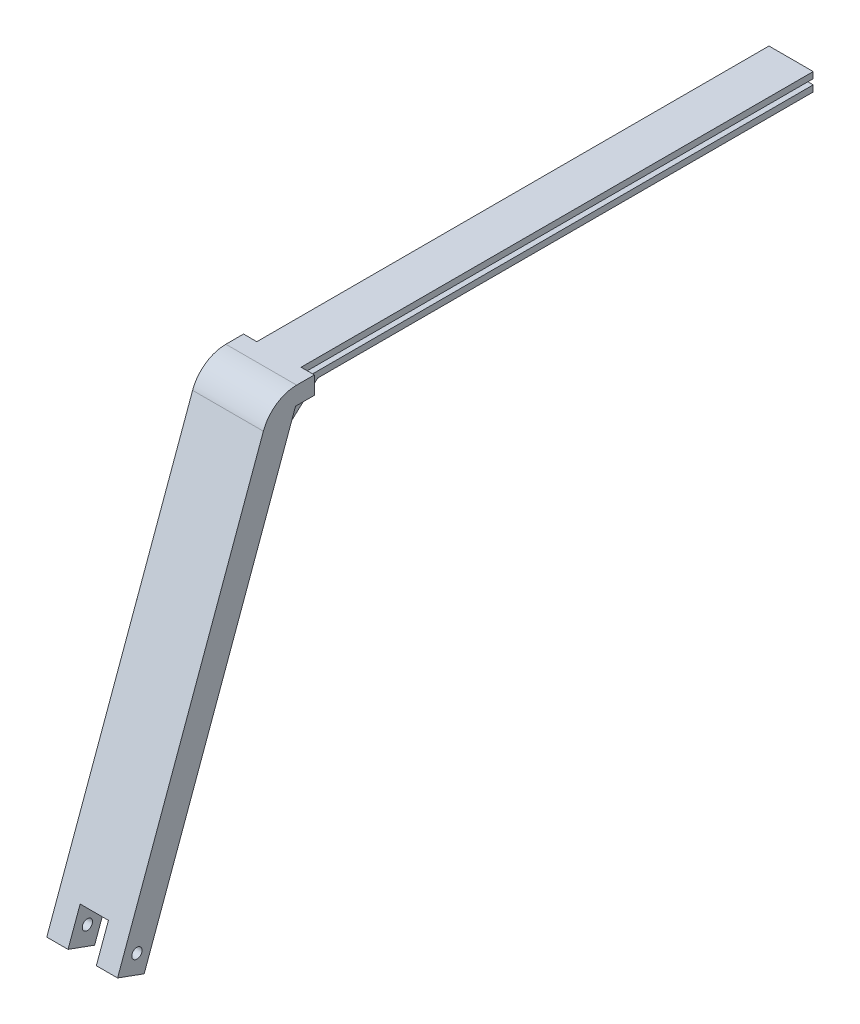
from build123d import *

# Parameters (mm, degrees)
BOSS_EXTRUDE1_DEPTH = 10
CHAMFER1_SIZE       = 7.802060087
CHAMFER1_SIZE_2     = 10
BOSS_EXTRUDE2_DEPTH = 20
SKETCH7_R           = 1.5
CUT_EXTRUDE1_DEPTH  = 20
CUT_EXTRUDE3_DEPTH  = 20
FILLET5_R           = 20
FILLET6_R           = 10
SKETCH10_W          = 5.3
SKETCH10_H          = 4.24
CUT_EXTRUDE4_DEPTH  = 273.805653344
SKETCH11_W          = 3.75
SKETCH11_H          = 144.691495626
CUT_EXTRUDE5_DEPTH  = 370.011076387
BOSS_EXTRUDE4_DEPTH = 12.5
SKETCH12_W          = 2
SKETCH12_H          = 1.5
CUT_EXTRUDE6_DEPTH  = 144.691496
CUT_EXTRUDE7_DEPTH  = 273.805653344
SKETCH15_W          = 8
SKETCH15_H          = 10
CUT_EXTRUDE8_DEPTH  = 234.574560204
SKETCH16_R          = 1.45
CUT_EXTRUDE9_DEPTH  = 230.270963046


with BuildPart() as part:
    # Sketch2 → Boss-Extrude1 (new, symmetric)
    with BuildSketch(Plane(origin=(0, 0, 0), x_dir=(0, 0, -1), z_dir=(1, 0, 0))):
        Polygon((36.072931518, 122.5), (-51.279924706, -117.5), (-51.279924706, -192), (-46.279924706, -192), (-46.279924706, -151.5), (-39.679924706, -151.5), (-39.679924706, -192), (-35.679924706, -192), (-35.679924706, -117.5), (-42.766502526, -117.5), (42.766502526, 117.5), (192.766502526, 117.5), (192.766502526, 122.5), align=None)
    extrude(amount=BOSS_EXTRUDE1_DEPTH, both=True)

    # Chamfer1
    # the kernel refuses this chamfer: 10, 7.802060087 mm, written as the material it adds along each edge
    with BuildSketch(Plane(origin=(-10, -117.5, 42.766502526), x_dir=(0, 0.9542611885293297, -0.298974219735734), z_dir=(1, 0, 0))) as chamfer1_piece_1_section:
        Polygon((CHAMFER1_SIZE * 0.998967402661, -CHAMFER1_SIZE * 0.0454326803806), (CHAMFER1_SIZE_2 * 0.298974219736, -CHAMFER1_SIZE_2 * 0.954261188529), (0, 0), align=None)
    chamfer1_piece_1 = extrude(amount=20, mode=Mode.PRIVATE)
    chamfer1_piece_1 = split(chamfer1_piece_1, bisect_by=Plane(origin=(0, -114.855220314, 35.679924706), z_dir=(0, 0, 1)), keep=Keep.TOP, mode=Mode.PRIVATE)
    add(chamfer1_piece_1)

    # Sketch6 → Boss-Extrude2 (add)
    with BuildSketch(Plane(origin=(10, 0, 0), x_dir=(0, 0, -1), z_dir=(1, 0, 0))):
        Polygon((-51.279924706, -180), (-66.279924706, -192), (-51.279924706, -192), align=None)
        Polygon((-35.679924706, -192), (-20.679924706, -192), (-35.679924706, -180), align=None)
    extrude(amount=-BOSS_EXTRUDE2_DEPTH)

    # Sketch7 → Cut-Extrude1 (cut)
    with BuildSketch(Plane(origin=(0, -192, 0), x_dir=(-1, 0, 0), z_dir=(0, -1, 0))):
        with Locations(Location((0, -56.279924706, 0), (0, 0, 90))):
            Circle(SKETCH7_R)
        with Locations(Location((0, -30.179924706, 0), (0, 0, 90))):
            Circle(SKETCH7_R)
    extrude(amount=-CUT_EXTRUDE1_DEPTH, mode=Mode.SUBTRACT)

    # Sketch9 → Cut-Extrude3 (cut)
    with BuildSketch(Plane(origin=(0, -187, 0), x_dir=(-1, 0, 0), z_dir=(0, -1, 0))):
        Polygon((2.75, -57.867637946), (2.75, -54.692211466), (0, -53.104498226), (-2.75, -54.692211466), (-2.75, -57.867637946), (0, -59.455351187), align=None)
        Polygon((2.75, -31.767637946), (2.75, -28.592211466), (0, -27.004498226), (-2.75, -28.592211466), (-2.75, -31.767637946), (0, -33.355351187), align=None)
    extrude(amount=-CUT_EXTRUDE3_DEPTH, mode=Mode.SUBTRACT)

    # Fillet5
    fillet5_edges = [part.edges().sort_by_distance(p)[0] for p in [
        (0, -117.5, 51.279924706),
    ]]
    fillet(fillet5_edges, radius=FILLET5_R)

    # Fillet6
    fillet6_edges = [part.edges().sort_by_distance(p)[0] for p in [
        (0, 122.5, -36.072931518),
    ]]
    fillet(fillet6_edges, radius=FILLET6_R)

    # Sketch10 → Cut-Extrude4 (cut, through all)
    with BuildSketch(Plane(origin=(10, 0, 0), x_dir=(0, 0, -1), z_dir=(1, 0, 0))):
        with Locations((-63.629924706, -189.88)):
            Rectangle(SKETCH10_W, SKETCH10_H)
        with Locations((-23.329924706, -189.88)):
            Rectangle(SKETCH10_W, SKETCH10_H)
    extrude(amount=-CUT_EXTRUDE4_DEPTH, mode=Mode.SUBTRACT)

    # Sketch11 → Cut-Extrude5 (cut, through all)
    with BuildSketch(Plane(origin=(0, 122.5, 0), x_dir=(1, 0, 0), z_dir=(0, 1, 0))):
        with Locations((-8.125, 120.420754713)):
            Rectangle(SKETCH11_W, SKETCH11_H)
        with Locations((8.125, 120.420754713)):
            Rectangle(SKETCH11_W, SKETCH11_H)
    extrude(amount=-CUT_EXTRUDE5_DEPTH, mode=Mode.SUBTRACT)

    # Sketch13 → Boss-Extrude4 (add)
    with BuildSketch(Plane(origin=(6.25, 0, 0), x_dir=(0, 0, -1), z_dir=(1, 0, 0))):
        Polygon((52.766502526, 117.5), (37.766502526, 103.762612903), (42.766502526, 117.5), align=None)
    extrude(amount=-BOSS_EXTRUDE4_DEPTH)

    # Sketch12 → Cut-Extrude6 (cut)
    with BuildSketch(Plane(origin=(0, 0, -192.766502526), x_dir=(-1, 0, 0), z_dir=(0, 0, -1))):
        with Locations((-5.25, 120)):
            Rectangle(SKETCH12_W, SKETCH12_H)
        with Locations((5.25, 120)):
            Rectangle(SKETCH12_W, SKETCH12_H)
    extrude(amount=-CUT_EXTRUDE6_DEPTH, mode=Mode.SUBTRACT)

    # Sketch14 → Cut-Extrude7 (cut, through all)
    with BuildSketch(Plane(origin=(10, 0, 0), x_dir=(0, 0, -1), z_dir=(1, 0, 0))):
        Polygon((-7.517540966, 2.736161147), (0, 0), (0, -210.65241273), (-80.454600392, -210.65241273), (-80.454600392, -132.997640023), align=None)
    extrude(amount=-CUT_EXTRUDE7_DEPTH, mode=Mode.SUBTRACT)

    # Sketch15 → Cut-Extrude8 (cut, through all)
    with BuildSketch(Plane(origin=(0, 2.736161147, 7.517540966), x_dir=(1, 0, 0), z_dir=(0, 0.3420201433256657, 0.9396926207859096))):
        with Locations((0, 5)):
            Rectangle(SKETCH15_W, SKETCH15_H)
    extrude(amount=-CUT_EXTRUDE8_DEPTH, mode=Mode.SUBTRACT)

    # Sketch16 → Cut-Extrude9 (cut, through all)
    with BuildSketch(Plane(origin=(10, 0, 0), x_dir=(0, 0, -1), z_dir=(1, 0, 0))):
        with Locations((-2.048669767, 6.066543677)):
            Circle(SKETCH16_R)
    extrude(amount=-CUT_EXTRUDE9_DEPTH, mode=Mode.SUBTRACT)


solid = part.part
